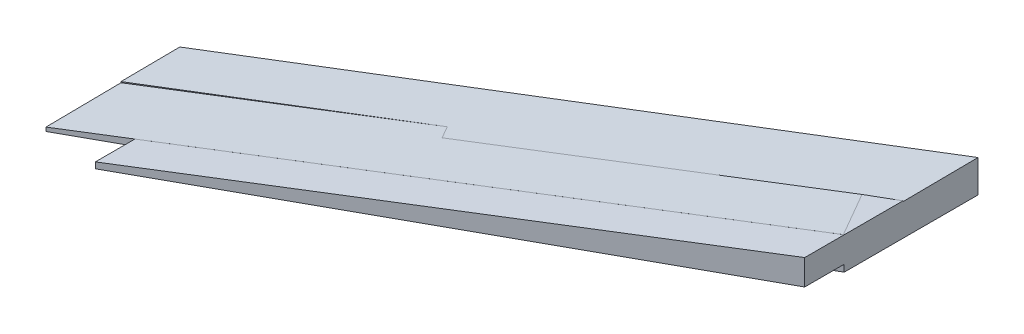
from build123d import *

# Parameters (mm, degrees)
BOSS_EXTRUDE1_START = -372.210901238
BOSS_EXTRUDE1_DEPTH = 761.529795247
CUT_EXTRUDE8_DEPTH  = 1524
CUT_EXTRUDE9_DEPTH  = 1524
SKETCH14_W          = 3140.03564449
SKETCH14_H          = 761.529795247
CUT_EXTRUDE10_DEPTH = 6096
SKETCH15_W          = 927.684379614
SKETCH15_H          = 598.997426742
BOSS_EXTRUDE2_DEPTH = 12192
CUT_EXTRUDE11_DEPTH = 2133.6


# Read off the part's stored shape, not the designer's step: Boss-Extrude1
with BuildPart() as part:
    # Boss-Extrude1 outline → Boss-Extrude1 (new body)
    with BuildSketch(Plane(origin=(0, 0, 0), x_dir=(1, 0, 0), z_dir=(0, 1, 0)).offset(BOSS_EXTRUDE1_START)):
        Polygon((0, -4287.259213253), (0, -1147.223568763), (-17157.695299777, -11053.223568763), (-17157.695299777, -14193.259213253), align=None)
    extrude(amount=BOSS_EXTRUDE1_DEPTH)

    # Sketch11 → Cut-Extrude8 (cut)
    with BuildSketch(Plane(origin=(496.762377184, 0, 860.417676572), x_dir=(-0.8660254037844379, 0, 0.5000000000000013), z_dir=(-0.5000000000000013, 0, -0.8660254037844379))):
        Polygon((20385.611784381, 8.553996386), (573.611784381, 389.318894009), (20385.611784381, 389.318894009), align=None)
        Polygon((573.611784381, -389.318894009), (20385.611784381, -389.318894009), (20385.611784381, -8.553996386), align=None)
    extrude(amount=-CUT_EXTRUDE8_DEPTH, mode=Mode.SUBTRACT)

    # Sketch13 → Cut-Extrude9 (cut)
    with BuildSketch(Plane(origin=(1856.437695643, 0, 3215.444409939), x_dir=(0.8660254037844379, 0, -0.5000000000000013), z_dir=(0.5000000000000013, 0, 0.8660254037844379))):
        Polygon((-20103.030058221, -31.301091644), (-2158.205820406, 389.318894009), (-20103.030058221, 389.318894009), align=None)
        Polygon((-20103.123390842, -50.047095366), (-20107.311653405, -470.646228494), (-2163.37704262, -649.329215787), align=None)
    extrude(amount=-CUT_EXTRUDE9_DEPTH, mode=Mode.SUBTRACT)

    # Sketch14 → Cut-Extrude10 (cut, along a direction that is not the sketch's normal)
    with BuildSketch(Plane.ZY.offset(17157.695299777)):
        with Locations((12623.241391008, 8.553996385)):
            Rectangle(SKETCH14_W, SKETCH14_H)
    extrude(amount=-CUT_EXTRUDE10_DEPTH, dir=(-0.8660254037844379, 0, 0.5000000000000014), mode=Mode.SUBTRACT)

    # Sketch15 → Boss-Extrude2 (add, along a direction that is not the sketch's normal)
    with BuildSketch(Plane(origin=(0, 0, 0), x_dir=(0, 0, -1), z_dir=(1, 0, 0))):
        with Locations((-4751.10140306, 89.820180638)):
            Rectangle(SKETCH15_W, SKETCH15_H)
    extrude(amount=-BOSS_EXTRUDE2_DEPTH, dir=(0.8657875976161161, 0.02343319053858119, -0.49986270254470566))

    # Sketch16 → Cut-Extrude11 (cut)
    with BuildSketch(Plane(origin=(2258.136815363, 0, 3911.20769465), x_dir=(0.8660254037844379, 0, -0.5000000000000013), z_dir=(0.5000000000000012, 0, 0.8660254037844378))):
        Polygon((-2607.471796433, -209.678532733), (-24747.672389043, -1017.49242809), (-23543.041613872, 86.741395035), align=None)
    extrude(amount=-CUT_EXTRUDE11_DEPTH, mode=Mode.SUBTRACT)


solid = part.part
